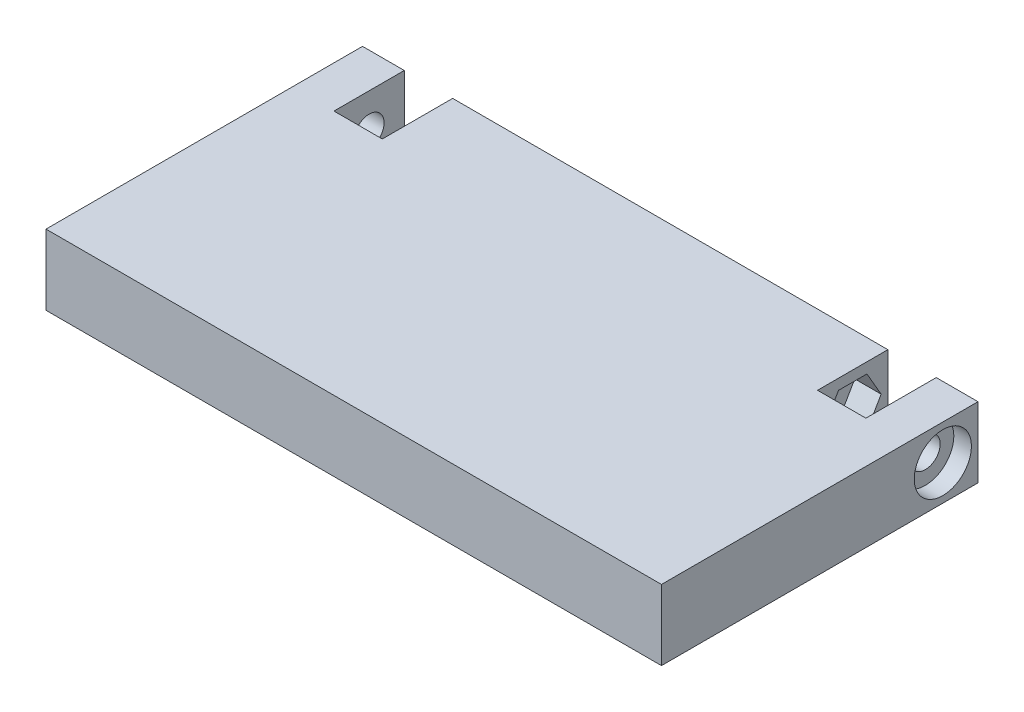
from build123d import *

# Parameters (mm, degrees)
SKETCH1_W                                  = 70
SKETCH1_H                                  = 36
BOSS_EXTRUDE1_DEPTH                        = 8
SKETCH2_W                                  = 5.5
SKETCH2_H                                  = 8
CUT_EXTRUDE1_DEPTH                         = 41.162171256
CBORE_START                                = 33
CBORE_FOR_M3_CHEESE_HEAD_SCREW1_OUTLINE_R  = 3.25
CBORE_FOR_M3_CHEESE_HEAD_SCREW1_DEPTH      = 2
CBORE_START_2                              = 30.25
CBORE_FOR_M3_CHEESE_HEAD_SCREW1_2_OUTLIN_R = 1.7
CBORE_FOR_M3_CHEESE_HEAD_SCREW1_2_DEPTH    = 2.75
CUT_EXTRUDE2_DEPTH                         = 3


# Read off the part's stored shape, not the designer's step: CBORE for M3 Cheese Head Screw1
with BuildPart() as part:
    # Sketch1 → Boss-Extrude1 (new body)
    with BuildSketch(Plane(origin=(0, 0, 0), x_dir=(1, 0, 0), z_dir=(0, 1, 0))):
        Rectangle(SKETCH1_W, SKETCH1_H)
    extrude(amount=BOSS_EXTRUDE1_DEPTH)

    # Sketch2 → Cut-Extrude1 (cut, through all)
    with BuildSketch(Plane(origin=(0, 8, 0), x_dir=(1, 0, 0), z_dir=(0, 1, 0))):
        with Locations((-27.5, 14)):
            Rectangle(SKETCH2_W, SKETCH2_H)
        with Locations((27.5, 14)):
            Rectangle(SKETCH2_W, SKETCH2_H)
    extrude(amount=-CUT_EXTRUDE1_DEPTH, mode=Mode.SUBTRACT)

    # CBORE for M3 Cheese Head Screw1 outline → CBORE for M3 Cheese Head Screw1 (cut)
    with BuildSketch(Plane.YZ.offset(CBORE_START)):
        with Locations((4, -14)):
            Circle(CBORE_FOR_M3_CHEESE_HEAD_SCREW1_OUTLINE_R)
    cbore_for_m3_cheese_head_screw1 = extrude(amount=CBORE_FOR_M3_CHEESE_HEAD_SCREW1_DEPTH, mode=Mode.SUBTRACT)

    # CBORE for M3 Cheese Head Screw1 2 outlin → CBORE for M3 Cheese Head Screw1 2 (cut)
    with BuildSketch(Plane.YZ.offset(CBORE_START_2)):
        with Locations((4, -14)):
            Circle(CBORE_FOR_M3_CHEESE_HEAD_SCREW1_2_OUTLIN_R)
    cbore_for_m3_cheese_head_screw1_2 = extrude(amount=CBORE_FOR_M3_CHEESE_HEAD_SCREW1_2_DEPTH, mode=Mode.SUBTRACT)

    # Sketch9 → Cut-Extrude2 (cut)
    with BuildSketch(Plane(origin=(24.75, 0, 0), x_dir=(0, 0, -1), z_dir=(1, 0, 0))):
        Polygon((15.616580754, 6.8), (12.383419246, 6.8), (10.766838493, 4), (12.383419246, 1.2), (15.616580754, 1.2), (17.233161507, 4), align=None)
    cut_extrude2 = extrude(amount=-CUT_EXTRUDE2_DEPTH, mode=Mode.SUBTRACT)

    # Mirror1: CBORE for M3 Cheese Head Screw1, CBORE for M3 Cheese Head Screw1 2, Cut-Extrude2 across plane
    add(cbore_for_m3_cheese_head_screw1.mirror(Plane(origin=(0, 0, 0), x_dir=(0, 0, 1), z_dir=(1, 0, 0))), mode=Mode.SUBTRACT)
    add(cbore_for_m3_cheese_head_screw1_2.mirror(Plane(origin=(0, 0, 0), x_dir=(0, 0, 1), z_dir=(1, 0, 0))), mode=Mode.SUBTRACT)
    add(cut_extrude2.mirror(Plane(origin=(0, 0, 0), x_dir=(0, 0, 1), z_dir=(1, 0, 0))), mode=Mode.SUBTRACT)


solid = part.part
